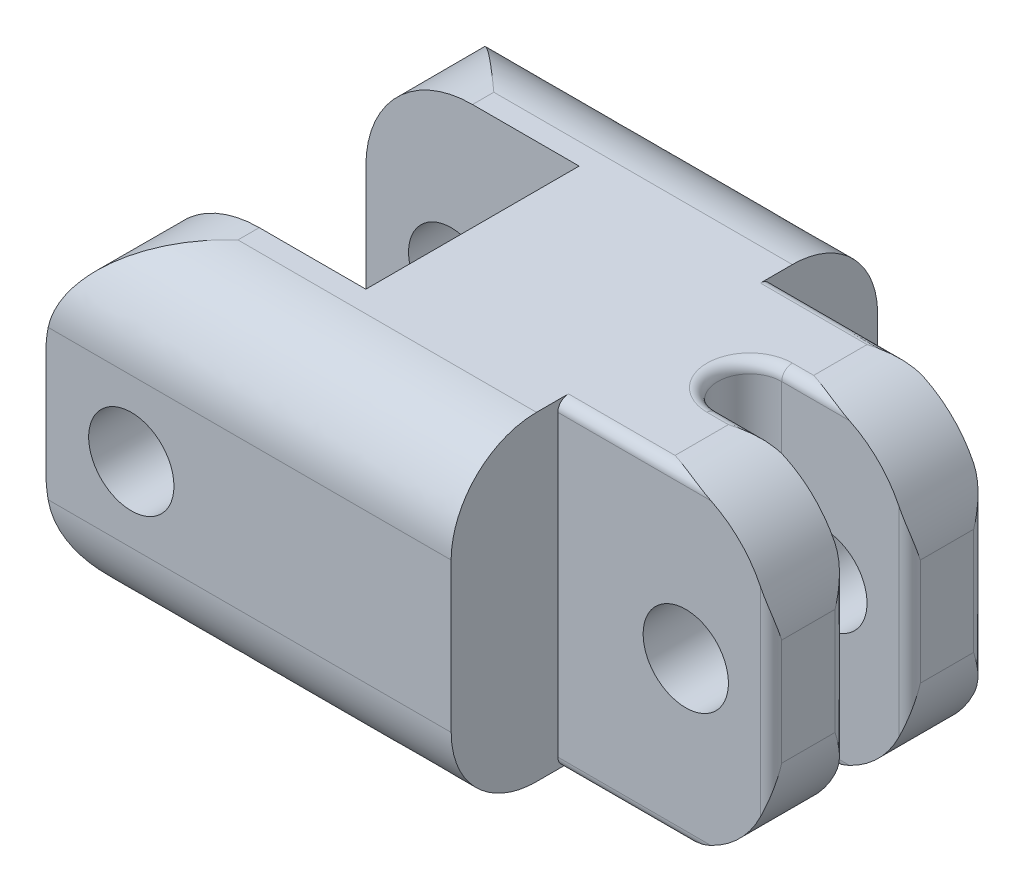
from build123d import *

# Parameters (mm, degrees)
BOSS_EXTRUDE1_DEPTH      = 16
BOSS_EXTRUDE1_DEPTH_BACK = 13
SKETCH1_W                = 20
SKETCH1_H                = 15
SKETCH2_W                = 10
SKETCH2_H                = 10
CUT_EXTRUDE1_DEPTH       = 19
VARFILLET1_R             = 4
VARFILLET2_R             = 4
CUT_EXTRUDE3_DEPTH       = 11
CUT_EXTRUDE3_DEPTH_BACK  = 11
SKETCH4_R                = 2
SKETCH5_W                = 10
SKETCH5_H                = 5
CUT_EXTRUDE4_DEPTH       = 19
FILLET1_R                = 0.5
CUT_EXTRUDE5_DEPTH       = 19
CUT_EXTRUDE5_DEPTH_BACK  = 19
SKETCH6_R                = 2
CUT_EXTRUDE6_DEPTH       = 19
CUT_EXTRUDE6_DEPTH_BACK  = 19


with BuildPart() as part:
    # Sketch1 → Boss-Extrude1 (new, two sides: drawn at the far end of the back side and taken through both)
    with BuildSketch(Plane(origin=(0, 0, 0), x_dir=(0, 0, -1), z_dir=(1, 0, 0)).offset(-BOSS_EXTRUDE1_DEPTH_BACK)):
        Rectangle(SKETCH1_W, SKETCH1_H)
    extrude(amount=BOSS_EXTRUDE1_DEPTH + BOSS_EXTRUDE1_DEPTH_BACK)

    # Sketch2 → Cut-Extrude1 (cut)
    with BuildSketch(Plane(origin=(0, 7.5, 0), x_dir=(1, 0, 0), z_dir=(0, 1, 0))):
        with Locations((-8, 0)):
            Rectangle(SKETCH2_W, SKETCH2_H)
    extrude(amount=-CUT_EXTRUDE1_DEPTH, mode=Mode.SUBTRACT)

    # VarFillet1
    varfillet1_edges = [part.edges().sort_by_distance(p)[0] for p in [
        (1.5, 7.5, -10),
        (1.5, 7.5, 10),
    ]]
    fillet(varfillet1_edges, radius=VARFILLET1_R)

    # VarFillet2
    varfillet2_edges = [part.edges().sort_by_distance(p)[0] for p in [
        (1.5, -7.5, 10),
        (1.5, -7.5, -10),
    ]]
    fillet(varfillet2_edges, radius=VARFILLET2_R)

    # Sketch4 → Cut-Extrude3 (cut, two sides: drawn at the far end of the back side and taken through both)
    with BuildSketch(Plane.XY.offset(-CUT_EXTRUDE3_DEPTH_BACK)):
        with Locations((-9, 0)):
            Circle(SKETCH4_R)
    extrude(amount=CUT_EXTRUDE3_DEPTH + CUT_EXTRUDE3_DEPTH_BACK, mode=Mode.SUBTRACT)

    # Sketch5 → Cut-Extrude4 (cut)
    with BuildSketch(Plane(origin=(0, 7.5, 0), x_dir=(1, 0, 0), z_dir=(0, 1, 0))):
        with Locations((11, 7.5)):
            Rectangle(SKETCH5_W, SKETCH5_H)
        with BuildLine():
            Line((16, 1.5), (10, 1.5))
            ThreePointArc((10, 1.5), (8.5, 0), (10, -1.5))
            Line((10, -1.5), (16, -1.5))
            Line((16, -1.5), (16, 1.5))
        make_face()
        with Locations((11, -7.5)):
            Rectangle(SKETCH5_W, SKETCH5_H)
    extrude(amount=-CUT_EXTRUDE4_DEPTH, mode=Mode.SUBTRACT)

    # Fillet1
    fillet1_edges = [part.edges().sort_by_distance(p)[0] for p in [
        (13, 7.5, -1.5),
        (13, 7.5, 1.5),
        (13, -7.5, 1.5),
        (13, -7.5, -1.5),
        (16, 0, 5),
        (16, 7.5, 3.25),
        (16, 0, 1.5),
        (16, -7.5, 3.25),
        (8.5, 7.5, 0),
        (8.5, -7.5, 0),
        (16, 0, -1.5),
        (16, 7.5, -3.25),
        (16, 0, -5),
        (16, -7.5, -3.25),
        (11, -7.5, -5),
        (11, -7.5, 5),
        (11, 7.5, -5),
        (11, 7.5, 5),
    ]]
    fillet(fillet1_edges, radius=FILLET1_R)

    # Sketch6 → Cut-Extrude5 (cut, two sides: drawn at the far end of the back side and taken through both)
    with BuildSketch(Plane.XY.offset(-CUT_EXTRUDE5_DEPTH_BACK)):
        with Locations((12, 0)):
            Circle(SKETCH6_R)
    extrude(amount=CUT_EXTRUDE5_DEPTH + CUT_EXTRUDE5_DEPTH_BACK, mode=Mode.SUBTRACT)

    # Sketch7 → Cut-Extrude6 (cut, two sides: drawn at the far end of the back side and taken through both)
    with BuildSketch(Plane.XY.offset(-CUT_EXTRUDE6_DEPTH_BACK)):
        with BuildLine():
            Line((-8, 7.5), (-13, 7.5))
            Line((-13, 7.5), (-13, 2.5))
            ThreePointArc((-13, 2.5), (-11.535533906, 6.035533906), (-8, 7.5))
        make_face()
        with BuildLine():
            Line((-13, -7.5), (-13, -2.5))
            ThreePointArc((-13, -2.5), (-11.535533906, -6.035533906), (-8, -7.5))
            Line((-8, -7.5), (-13, -7.5))
        make_face()
        with BuildLine():
            Line((11, 7.5), (16, 7.5))
            Line((16, 7.5), (16, 2.5))
            ThreePointArc((16, 2.5), (14.535533906, 6.035533906), (11, 7.5))
        make_face()
        with BuildLine():
            Line((16, -7.5), (16, -2.5))
            ThreePointArc((16, -2.5), (14.535533906, -6.035533906), (11, -7.5))
            Line((11, -7.5), (16, -7.5))
        make_face()
    extrude(amount=CUT_EXTRUDE6_DEPTH + CUT_EXTRUDE6_DEPTH_BACK, mode=Mode.SUBTRACT)


solid = part.part
